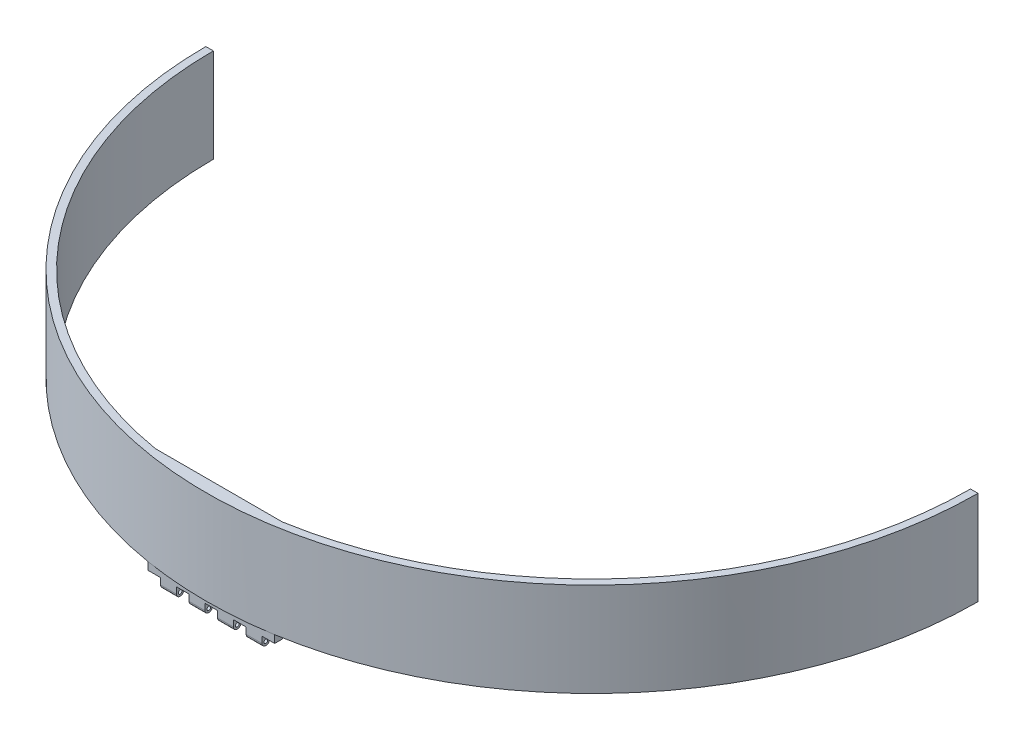
from build123d import *

# Parameters (mm, degrees)
SKETCH1_W              = 50
SKETCH1_H              = 3
BOSS_EXTRUDE1_DEPTH    = 40
SKETCH2_W              = 6.25
SKETCH2_H              = 3
BOSS_EXTRUDE2_DEPTH    = 4
FILLET1_R              = 1.5
LPATTERN1_COUNT        = 4
LPATTERN1_PITCH        = 11.25
FILLET1_OF_LPATTERN1_R = 1.5
SKETCH3_W              = 3
SKETCH3_H              = 37
SKETCH8_R              = 0.75
CUT_EXTRUDE1_DEPTH     = 232.430553417
CUT_EXTRUDE2_DEPTH     = 218.721568988


with BuildPart() as part:
    # Sketch1 → Boss-Extrude1 (new body)
    with BuildSketch(Plane(origin=(0, 0, 0), x_dir=(1, 0, 0), z_dir=(0, 1, 0))):
        Rectangle(SKETCH1_W, SKETCH1_H)
    extrude(amount=BOSS_EXTRUDE1_DEPTH)

    # Sketch2 → Boss-Extrude2 (add)
    with BuildSketch(Plane.XZ):
        with Locations((-16.875, 0)):
            Rectangle(SKETCH2_W, SKETCH2_H)
    boss_extrude2 = extrude(amount=BOSS_EXTRUDE2_DEPTH)

    # Fillet1
    fillet1_edges = [part.edges().sort_by_distance(p)[0] for p in [
        (-16.875, -4, 1.5),
        (-16.875, -4, -1.5),
    ]]
    fillet(fillet1_edges, radius=FILLET1_R - 0.0001)  # a hair under: the kernel refuses the full size

    # LPattern1: Boss-Extrude2 ×4
    with Locations(*[(i * LPATTERN1_PITCH, 0, 0) for i in range(1, LPATTERN1_COUNT)]):
        add(boss_extrude2)

    # Fillet1 of LPattern1
    fillet1_of_lpattern1_edges = [part.edges().sort_by_distance(p)[0] for p in [
        (-5.625, -4, 1.5),
        (-5.625, -4, -1.5),
        (5.625, -4, 1.5),
        (5.625, -4, -1.5),
        (16.875, -4, 1.5),
        (16.875, -4, -1.5),
    ]]
    fillet(fillet1_of_lpattern1_edges, radius=FILLET1_OF_LPATTERN1_R - 0.0001)  # a hair under: the kernel refuses the full size

    # Sweep2: sweep along a path in Sketch7
    with BuildLine(Plane(origin=(0, 38.5, 0), x_dir=(1, 0, 0), z_dir=(0, 1, 0))) as sweep2_path:
        ThreePointArc((-149.86, 148.775138892), (0, -1.084861108), (149.86, 148.775138892))
    # Sketch3 → Sweep2 (sweep)
    with BuildSketch(Plane(origin=(25, 0, 0), x_dir=(0, 0, -1), z_dir=(1, 0, 0))):
        with Locations((0, 21.5)):
            Rectangle(SKETCH3_W, SKETCH3_H)
    sweep(path=sweep2_path.line)

    # Sketch8 → Cut-Extrude1 (cut, through all)
    with BuildSketch(Plane.ZY.offset(20)):
        with Locations((0, -2.5)):
            Circle(SKETCH8_R)
    extrude(amount=-CUT_EXTRUDE1_DEPTH, mode=Mode.SUBTRACT)

    # Sketch9 → Cut-Extrude2 (cut, through all)
    with BuildSketch(Plane(origin=(0, 40, 0), x_dir=(1, 0, 0), z_dir=(0, 1, 0))):
        Polygon((-149.381926595, 148.694252085), (-152.34044383, 148.694252085), (-152.443464298, 148.694252085), (-152.443464298, 149.267987832), align=None)
        Polygon((152.339887493, 148.355558597), (149.339735724, 148.355558597), (149.381926595, 148.856025699), align=None)
    extrude(amount=-CUT_EXTRUDE2_DEPTH, mode=Mode.SUBTRACT)


solid = part.part
